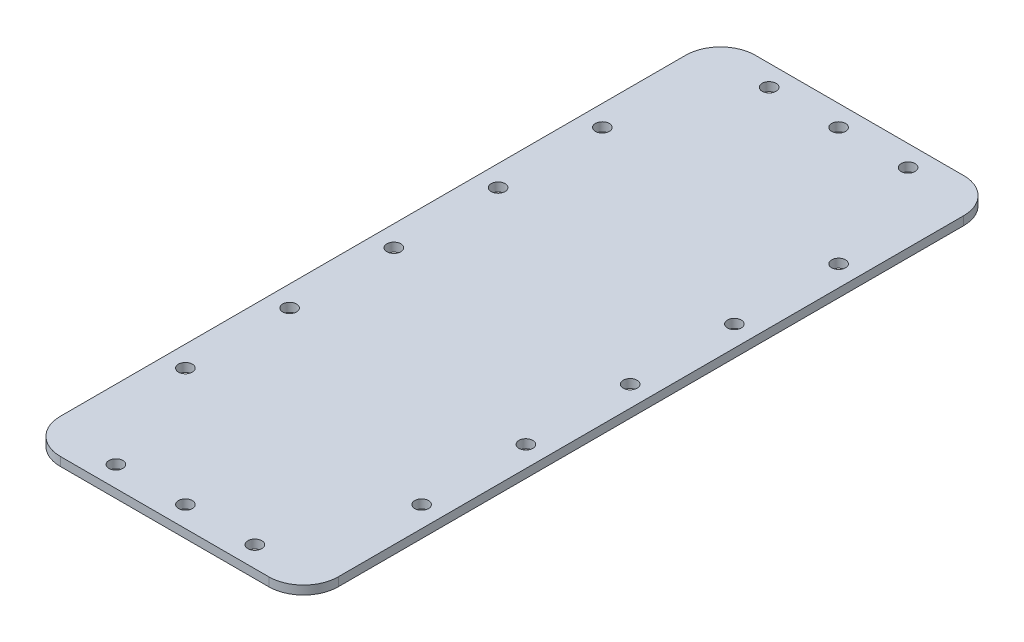
from build123d import *

# Parameters (mm, degrees)
SKETCH1_W           = 101.6
SKETCH1_H           = 254
BOSS_EXTRUDE1_DEPTH = 3.175
SKETCH2_R           = 2.54
CUT_EXTRUDE1_DEPTH  = 223.663234681
FILLET1_R           = 12.7


with BuildPart() as part:
    # Sketch1 → Boss-Extrude1 (new body)
    with BuildSketch(Plane(origin=(0, 0, 0), x_dir=(1, 0, 0), z_dir=(0, 1, 0))):
        with Locations((20.100372359, -84.049692378)):
            Rectangle(SKETCH1_W, SKETCH1_H)
    extrude(amount=BOSS_EXTRUDE1_DEPTH)

    # Sketch2 → Cut-Extrude1 (cut, through all)
    with BuildSketch(Plane(origin=(0, 3.175, 0), x_dir=(1, 0, 0), z_dir=(0, 1, 0))):
        with Locations((-5.299627641, 35.330307622)):
            Circle(SKETCH2_R)
        with Locations((20.100372359, 35.330307622)):
            Circle(SKETCH2_R)
        with Locations((45.500372359, 35.330307622)):
            Circle(SKETCH2_R)
        with Locations((-23.079627641, -84.049692378)):
            Circle(SKETCH2_R)
        with Locations((-23.079627641, -45.949692378)):
            Circle(SKETCH2_R)
        with Locations((-23.079627641, -7.849692378)):
            Circle(SKETCH2_R)
        with Locations((63.280372359, -7.849692378)):
            Circle(SKETCH2_R)
        with Locations((63.280372359, -45.949692378)):
            Circle(SKETCH2_R)
        with Locations((63.280372359, -84.049692378)):
            Circle(SKETCH2_R)
        with Locations((63.280372359, -122.149692378)):
            Circle(SKETCH2_R)
        with Locations((63.280372359, -160.249692378)):
            Circle(SKETCH2_R)
        with Locations((-23.079627641, -160.249692378)):
            Circle(SKETCH2_R)
        with Locations((-23.079627641, -122.149692378)):
            Circle(SKETCH2_R)
        with Locations((45.500372359, -203.429692378)):
            Circle(SKETCH2_R)
        with Locations((20.100372359, -203.429692378)):
            Circle(SKETCH2_R)
        with Locations((-5.299627641, -203.429692378)):
            Circle(SKETCH2_R)
    extrude(amount=-CUT_EXTRUDE1_DEPTH, mode=Mode.SUBTRACT)

    # Fillet1
    fillet1_edges = [part.edges().sort_by_distance(p)[0] for p in [
        (-30.699627641, 1.5875, 211.049692378),
        (70.900372359, 1.5875, 211.049692378),
        (70.900372359, 1.5875, -42.950307622),
        (-30.699627641, 1.5875, -42.950307622),
    ]]
    fillet(fillet1_edges, radius=FILLET1_R)


solid = part.part
